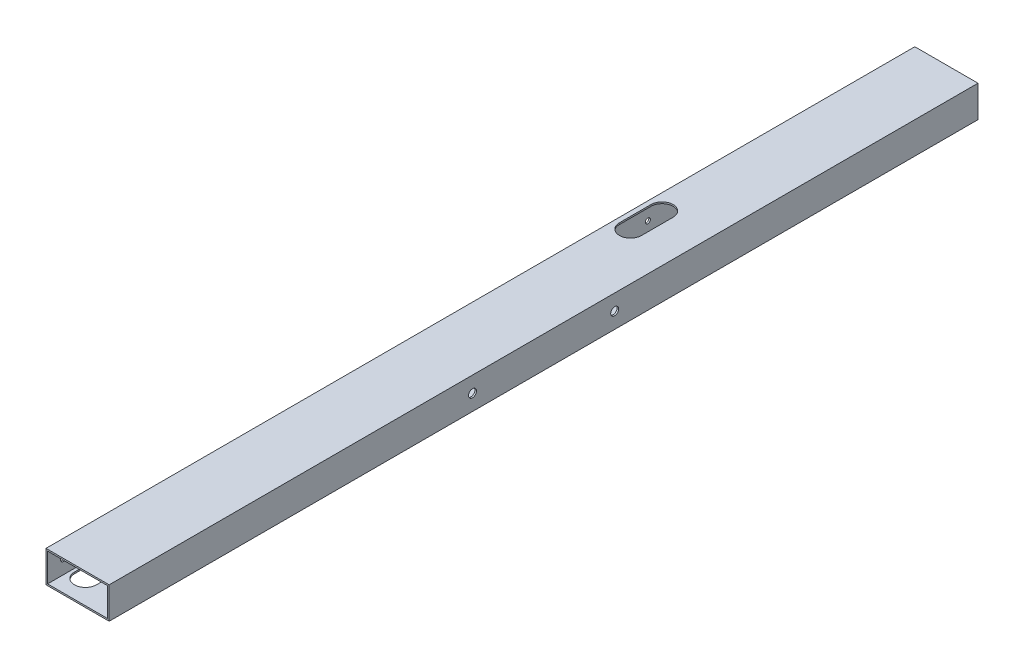
from build123d import *

# Parameters (mm, degrees)
SKETCH_1_W             = 40
SKETCH_1_H             = 20
SKETCH_1_W_2           = 38
SKETCH_1_H_2           = 18
EXTRUDE_1_DEPTH        = 550
SKETCH_4_R             = 1.75
CUT_EXTRUDE_2_DEPTH    = 1.5
SKETCH_6_R             = 2.5
CUT_EXTRUDE_3_DEPTH    = 552.815186453
SKETCH_7_R             = 1.6
CUT_EXTRUDE_4_DEPTH    = 10
CUT_EXTRUDE_5_DEPTH    = 10
PATTERN_LINEAR_2_COUNT = 2
PATTERN_LINEAR_2_PITCH = 510
CUT_EXTRUDE_6_DEPTH    = 10


with BuildPart() as part:
    # 草图1 → 拉伸-薄壁1 (new body)
    with BuildSketch(Plane.XY):
        with Locations((20, -10)):
            Rectangle(SKETCH_1_W, SKETCH_1_H)
        with Locations((20, -10)):
            Rectangle(SKETCH_1_W_2, SKETCH_1_H_2, mode=Mode.SUBTRACT)
    extrude(amount=EXTRUDE_1_DEPTH)

    # 草图4 → 切除-拉伸2 (cut)
    with BuildSketch(Plane.ZY):
        with Locations((539.996387591, -10)):
            Circle(SKETCH_4_R)
        with Locations((10, -10.000000002)):
            Circle(SKETCH_4_R)
    extrude(amount=-CUT_EXTRUDE_2_DEPTH, mode=Mode.SUBTRACT)

    # 草图6 → 切除-拉伸3 (cut, through all)
    with BuildSketch(Plane(origin=(40, 0, 0), x_dir=(0, 0, -1), z_dir=(1, 0, 0))):
        with Locations((-320, -10)):
            Circle(SKETCH_6_R)
        with Locations((-230, -10)):
            Circle(SKETCH_6_R)
    extrude(amount=-CUT_EXTRUDE_3_DEPTH, mode=Mode.SUBTRACT)

    # 草图7 → 切除-拉伸4 (cut)
    with BuildSketch(Plane.ZY):
        with Locations((190, -10)):
            Circle(SKETCH_7_R)
        with Locations((170, -10)):
            Circle(SKETCH_7_R)
    extrude(amount=-CUT_EXTRUDE_4_DEPTH, mode=Mode.SUBTRACT)

    # 草图8 → 切除-拉伸5 (cut)
    with BuildSketch(Plane.XZ.offset(20)):
        with BuildLine():
            Line((3, 15), (3, 25))
            ThreePointArc((3, 25), (10, 32), (17, 25))
            Line((17, 25), (17, 15))
            ThreePointArc((17, 15), (10, 8), (3, 15))
        make_face()
    cut_extrude_5 = extrude(amount=-CUT_EXTRUDE_5_DEPTH, mode=Mode.SUBTRACT)

    # 阵列(线性)2: 切除-拉伸5 ×2
    with Locations(*[(0, 0, i * PATTERN_LINEAR_2_PITCH) for i in range(1, PATTERN_LINEAR_2_COUNT)]):
        add(cut_extrude_5, mode=Mode.SUBTRACT)

    # 草图9 → 切除-拉伸6 (cut)
    with BuildSketch(Plane(origin=(0, 0, 0), x_dir=(1, 0, 0), z_dir=(0, 1, 0))):
        with BuildLine():
            Line((3, -190), (3, -170))
            ThreePointArc((3, -170), (10, -163), (17, -170))
            Line((17, -170), (17, -190))
            ThreePointArc((17, -190), (10, -197), (3, -190))
        make_face()
    extrude(amount=-CUT_EXTRUDE_6_DEPTH, mode=Mode.SUBTRACT)


solid = part.part
